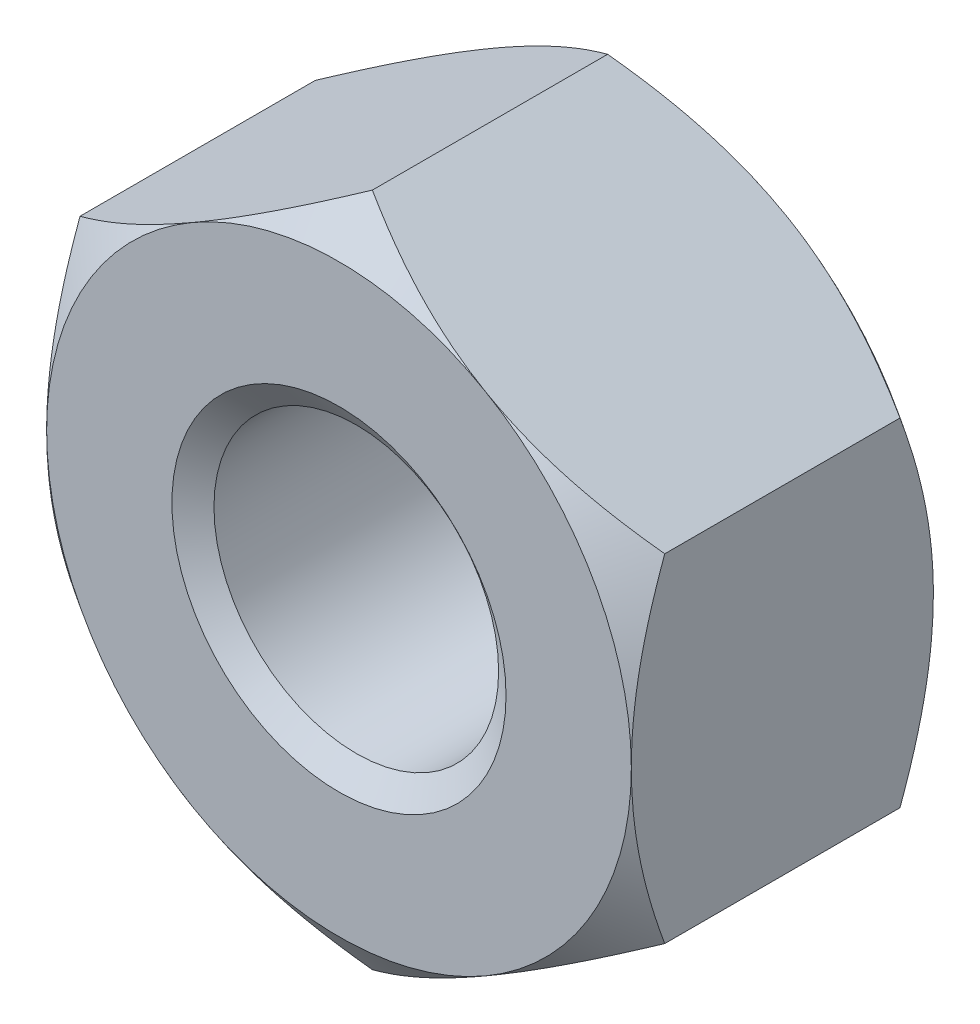
from build123d import *

# Parameters (mm, degrees)
BASENUT_START = -5.7404
BASENUTSKE_R  = 2.7051
BASENUT_DEPTH = 5.7404
SCALE1_SCALE  = 0.66


# Read off the part's stored shape, not the designer's step: ThreadSchematic
with BuildPart() as part:
    # BaseNutSke → BaseNut (new body)
    with BuildSketch(Plane.XY.offset(BASENUT_START)):
        Polygon((5.55625, 3.207902433), (5.55625, -3.207902433), (0, -6.415804866), (-5.55625, -3.207902433), (-5.55625, 3.207902433), (0, 6.415804866), align=None)
        Circle(BASENUTSKE_R, mode=Mode.SUBTRACT)
    extrude(amount=BASENUT_DEPTH)

    # Sketch5 (on Front Plane) → EndChamfer (revolve, cut)
    with BuildSketch(Plane.XY):
        Polygon((5.715, 3.175), (5.353069726, 2.65811), (5.7658, 2.65811), (5.7658, 3.175), align=None)
    revolve(axis=Axis((5.715, 3.175, 0), (-0.5735764363510442, -0.8191520442889932, 0)), mode=Mode.SUBTRACT)

    # Sketch3 → Double-Chamfer (revolve, cut)
    with BuildSketch(Plane(origin=(0, 0, 0), x_dir=(0, 0, -1), z_dir=(1, 0, 0))):
        Polygon((5.7404, 5.55625), (5.1054, 6.415804866), (5.1054, 19.115804866), (18.4404, 19.115804866), (18.4404, 5.55625), align=None)
        Polygon((0.635, 19.115804866), (-12.7, 19.115804866), (-12.7, 5.55625), (0, 5.55625), (0.635, 6.415804866), align=None)
    revolve(axis=Axis((0, 0, 0), (0, 0, -1)), mode=Mode.SUBTRACT)

    # ThreadSchematic outline → ThreadSchematic (revolve, cut)
    with BuildSketch(Plane.XZ):
        Polygon((2.7051, 0), (2.7051, -0.329027522), (3.175, 0), align=None)
        Polygon((3.175, -5.715), (2.7051, -5.385972478), (2.7051, -5.7404), (3.175, -5.7404), align=None)
    revolve(axis=Axis((0, 0, 0), (0, 0, 1)), mode=Mode.SUBTRACT)


with BuildPart() as part_1:
    # Scale1: scaled about (0, 0, -2.868948271)
    add(part.part.scale(SCALE1_SCALE).moved(Location((0, 0, -0.975442412))))


solid = part_1.part
